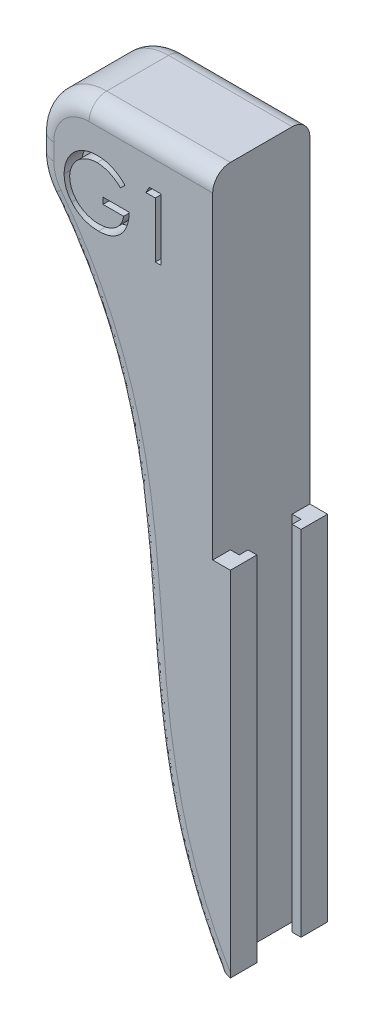
from build123d import *

# Parameters (mm, degrees)
EXTRUSION1_DEPTH = 5.5
EXTRUSION2_START = -19
EXTRUSION2_DEPTH = 20
CONG_5_R         = 3
CONG_6_R         = 1
EXTRUSION3_START = 4.5
EXTRUSION3_DEPTH = 1
EXTRUSION4_DEPTH = 1


# Read off the part's stored shape, not the designer's step: Extrusion3, Extrusion4
with BuildPart() as part:
    # Esquisse1 → Extrusion1 (new body)
    with BuildSketch(Plane.XY):
        with BuildLine():
            Line((0, 0), (0, 39))
            Line((0, 39), (-10, 39))
            Line((-10, 39), (-10, 34))
            add(Edge.make_bspline(
                [(-10, 34), (-7.394585864, 30.894988343), (-2.437496235, 20.047320541), (-4.724513139, 8.183096798), (0, 0)],
                knots=[0, 0, 0, 0, 0.313213028, 1, 1, 1, 1], degree=3))
        make_face()
    extrude(amount=EXTRUSION1_DEPTH)

    # Esquisse2 → Extrusion2 (add)
    with BuildSketch(Plane(origin=(0, 39, 0), x_dir=(1, 0, 0), z_dir=(0, 1, 0)).offset(EXTRUSION2_START)):
        Polygon((0, 0), (1, 0), (1, -1.5), (0.5, -1.5), (0.5, -1), (0, -1), align=None)
        Polygon((0, -5.5), (1, -5.5), (1, -4), (0.5, -4), (0.5, -4.5), (0, -4.5), align=None)
    extrude(amount=-EXTRUSION2_DEPTH)

    # Congé5
    cong_5_edges = [part.edges().sort_by_distance(p)[0] for p in [
        (-10, 39, 2.75),
        (-10, 34, 2.75),
    ]]
    fillet(cong_5_edges, radius=CONG_5_R)

    # Congé6
    cong_6_edges = [part.edges().sort_by_distance(p)[0] for p in [
        (-3.5, 39, 0),
        (-3.5, 39, 5.5),
        (-9.121320344, 38.121320344, 5.5),
        (-9.121320344, 38.121320344, 0),
        (-10, 35.528303094, 5.5),
        (-10, 35.528303094, 0),
        (-9.839363686, 34.088095032, 5.5),
        (-9.839363686, 34.088095032, 0),
        (-3.989072638, 16.865750758, 0),
        (-3.989072638, 16.865750758, 5.5),
    ]]
    fillet(cong_6_edges, radius=CONG_6_R)

    # Extrusion3 outline → Extrusion3 (cut)
    with BuildSketch(Plane.XY.offset(EXTRUSION3_START)):
        with BuildLine():
            add(Edge.make_bspline(
                [(-6.529186974, 36.577571008), (-6.49294873, 36.576991516), (-6.421092552, 36.575842452), (-6.314166819, 36.567877804), (-6.208893805, 36.555253923), (-6.105117415, 36.538027136), (-6.003191049, 36.514563446), (-5.902824343, 36.486485161), (-5.803871807, 36.453793339), (-5.706643558, 36.414804492), (-5.610485842, 36.370550867), (-5.514864001, 36.320737445), (-5.420104755, 36.26451244), (-5.326043774, 36.201708905), (-5.232087916, 36.133405487), (-5.139723274, 36.057648663), (-5.046720329, 35.977425907), (-4.986918515, 35.919743724), (-4.956570788, 35.890471649)],
                knots=[0, 0, 0, 0, 0.061616945, 0.122179161, 0.18221627, 0.241864129, 0.300960056, 0.359969068, 0.419032918, 0.478068687, 0.537992581, 0.59896023, 0.661321079, 0.725247569, 0.791220154, 0.858745972, 0.928317581, 1, 1, 1, 1], degree=3))
            add(Edge.make_bspline(
                [(-8.411698993, 34.739229662), (-8.411166755, 34.780395914), (-8.410109043, 34.862205222), (-8.397283527, 34.983662529), (-8.378882109, 35.102963222), (-8.351835055, 35.220009778), (-8.31773879, 35.33488037), (-8.275185304, 35.447628333), (-8.225640408, 35.558320205), (-8.168054912, 35.666194073), (-8.103970452, 35.769818486), (-8.034420232, 35.868776289), (-7.958416632, 35.961265354), (-7.877200832, 36.048457002), (-7.789803842, 36.129255849), (-7.697044418, 36.20440996), (-7.598851075, 36.274020146), (-7.494914895, 36.336989981), (-7.386787211, 36.393553601), (-7.274727209, 36.443142813), (-7.158769099, 36.484126128), (-7.039781621, 36.518899908), (-6.91686412, 36.544615049), (-6.790908583, 36.563263794), (-6.661258471, 36.576024394), (-6.573622442, 36.577050649), (-6.529186974, 36.577571008)],
                knots=[0, 0, 0, 0, 0.04203938, 0.083544465, 0.124643057, 0.165303063, 0.206170747, 0.24697072, 0.288329266, 0.329986533, 0.371797473, 0.412737629, 0.453459281, 0.494001342, 0.534380668, 0.574951545, 0.615891702, 0.657249559, 0.699006607, 0.740486274, 0.782325156, 0.824567455, 0.867041244, 0.910499531, 0.954619176, 1, 1, 1, 1], degree=3))
            add(Edge.make_bspline(
                [(-7.982612455, 33.559942803), (-8.016798387, 33.602613456), (-8.084602799, 33.687246473), (-8.171880956, 33.822846417), (-8.246282359, 33.963248278), (-8.306650181, 34.108842906), (-8.353788267, 34.259494119), (-8.38759452, 34.41500941), (-8.407401809, 34.575589041), (-8.410255347, 34.684254305), (-8.411698993, 34.739229662)],
                knots=[0, 0, 0, 0, 0.127895677, 0.253668418, 0.376738432, 0.499344473, 0.621999307, 0.745698548, 0.871345153, 1, 1, 1, 1], degree=3))
            add(Edge.make_bspline(
                [(-6.466086013, 32.898083828), (-6.505596148, 32.89865295), (-6.583522869, 32.89977544), (-6.698613797, 32.907752788), (-6.810531417, 32.920033364), (-6.919259426, 32.938578487), (-7.025197768, 32.961293142), (-7.127817353, 32.99037986), (-7.227509095, 33.02404856), (-7.324427081, 33.062344233), (-7.417691628, 33.10671589), (-7.507718145, 33.156025529), (-7.595004271, 33.21001889), (-7.678955436, 33.269629736), (-7.760009057, 33.334412196), (-7.837642501, 33.404496115), (-7.912290379, 33.479667235), (-7.959050842, 33.533046244), (-7.982612455, 33.559942803)],
                knots=[0, 0, 0, 0, 0.069236524, 0.136556739, 0.202094157, 0.26646426, 0.329768823, 0.391878966, 0.453270593, 0.514114664, 0.57438951, 0.634141664, 0.693923287, 0.754152196, 0.814470164, 0.87566063, 0.937348011, 1, 1, 1, 1], degree=3))
            add(Edge.make_bspline(
                [(-4.732211814, 34.692955623), (-4.733917662, 34.626048134), (-4.737256316, 34.495098093), (-4.760675231, 34.304127822), (-4.798491744, 34.123756129), (-4.850152055, 33.953793057), (-4.917027336, 33.794479464), (-4.998399864, 33.645653598), (-5.095571985, 33.508276917), (-5.205082427, 33.381227914), (-5.327982385, 33.267898701), (-5.460951004, 33.168292763), (-5.604207973, 33.084390148), (-5.75761778, 33.016129486), (-5.920678214, 32.962855491), (-6.093766594, 32.925083914), (-6.276648194, 32.902453951), (-6.401984871, 32.899562571), (-6.466086013, 32.898083828)],
                knots=[0, 0, 0, 0, 0.071272278, 0.139492722, 0.204635419, 0.26740574, 0.328445598, 0.388397163, 0.447733931, 0.507391621, 0.566767555, 0.625478338, 0.684066506, 0.743248446, 0.804033357, 0.866498751, 0.931723238, 1, 1, 1, 1], degree=3))
            Line((-4.732211814, 34.692955623), (-6.212981045, 34.692955623))
            Line((-6.212981045, 34.692955623), (-6.212981045, 34.333981264))
            Line((-6.212981045, 34.333981264), (-5.046314378, 34.333981264))
            add(Edge.make_bspline(
                [(-6.438742263, 33.257058187), (-6.393363915, 33.258006764), (-6.304256158, 33.259869447), (-6.173269715, 33.274369737), (-6.047466645, 33.29701653), (-5.927200441, 33.330182427), (-5.812331421, 33.372486102), (-5.702438479, 33.423481489), (-5.598386821, 33.485124548), (-5.499863647, 33.554698415), (-5.409106462, 33.632213247), (-5.327252338, 33.715857702), (-5.255606848, 33.805225769), (-5.193102149, 33.899791084), (-5.141393495, 34.000336389), (-5.0989507, 34.106368952), (-5.066417408, 34.217936464), (-5.053062433, 34.295028096), (-5.046314378, 34.333981264)],
                knots=[0, 0, 0, 0, 0.070630068, 0.138693613, 0.204917715, 0.269440883, 0.332636335, 0.395301694, 0.457763931, 0.52065702, 0.582851652, 0.643315198, 0.702580232, 0.760907539, 0.819489613, 0.878269076, 0.938491311, 1, 1, 1, 1], degree=3))
            add(Edge.make_bspline(
                [(-8.097596429, 34.753252098), (-8.096840711, 34.72098128), (-8.095331338, 34.656527767), (-8.085671018, 34.560333694), (-8.067742778, 34.465568292), (-8.043775069, 34.371920159), (-8.013794253, 34.279228911), (-7.976421587, 34.187896401), (-7.932155987, 34.09792601), (-7.880919435, 34.010128393), (-7.824733231, 33.92460537), (-7.76179015, 33.844045848), (-7.694929567, 33.767377071), (-7.621715667, 33.696301307), (-7.544496125, 33.62891741), (-7.460963849, 33.567081889), (-7.372761388, 33.509603665), (-7.279754176, 33.457207146), (-7.182951394, 33.41039861), (-7.083694641, 33.368774714), (-6.981666825, 33.334495377), (-6.877404136, 33.306557273), (-6.771030864, 33.283656976), (-6.662007061, 33.268924495), (-6.551134353, 33.258233664), (-6.476395721, 33.257451994), (-6.438742263, 33.257058187)],
                knots=[0, 0, 0, 0, 0.038994203, 0.077881926, 0.116651567, 0.155416065, 0.194618293, 0.234261464, 0.274547108, 0.315667309, 0.357019556, 0.398082512, 0.439097864, 0.479833278, 0.521274132, 0.562840828, 0.605292061, 0.64840866, 0.691727292, 0.735148885, 0.778368925, 0.821660858, 0.865523699, 0.909731498, 0.954522565, 1, 1, 1, 1], degree=3))
            add(Edge.make_bspline(
                [(-6.539703801, 36.218596649), (-6.573618501, 36.218183043), (-6.641359942, 36.217356904), (-6.741981886, 36.206812689), (-6.841548523, 36.191647825), (-6.939871897, 36.169705947), (-7.037143184, 36.141896887), (-7.133024076, 36.107111424), (-7.227693431, 36.06655618), (-7.320259512, 36.019693706), (-7.410000015, 35.96821386), (-7.494756851, 35.911165319), (-7.57507025, 35.850376529), (-7.649430675, 35.78432555), (-7.718265862, 35.713610685), (-7.783214234, 35.639547378), (-7.84199153, 35.56011216), (-7.895082695, 35.476766534), (-7.942444313, 35.390974345), (-7.984252966, 35.303561355), (-8.019350055, 35.2148175), (-8.04711951, 35.124631423), (-8.070030164, 35.033700833), (-8.086147771, 34.941396112), (-8.095234493, 34.847618427), (-8.096806273, 34.784821169), (-8.097596429, 34.753252098)],
                knots=[0, 0, 0, 0, 0.042841197, 0.085571284, 0.127718668, 0.170068387, 0.212787245, 0.255481593, 0.298877091, 0.342860572, 0.386527586, 0.429532376, 0.471886213, 0.513729302, 0.555081706, 0.596535237, 0.638120075, 0.679822212, 0.721331468, 0.761888364, 0.802199329, 0.841806293, 0.881060412, 0.920633226, 0.960101199, 1, 1, 1, 1], degree=3))
            add(Edge.make_bspline(
                [(-5.225801557, 35.635263316), (-5.274520446, 35.681094179), (-5.370796492, 35.771663042), (-5.527756735, 35.889174037), (-5.691520369, 35.989840137), (-5.861232866, 36.071746373), (-6.032691419, 36.137099134), (-6.203620196, 36.183627274), (-6.372265897, 36.213299811), (-6.484433115, 36.216848181), (-6.539703801, 36.218596649)],
                knots=[0, 0, 0, 0, 0.136144491, 0.269042539, 0.398516618, 0.527099539, 0.652282545, 0.771680405, 0.887494932, 1, 1, 1, 1], degree=3))
            Line((-5.225801557, 35.635263316), (-4.956570788, 35.890471649))
        make_face()
        Polygon((-3.584475436, 36.487827418), (-3.789904121, 36.128853059), (-3.251442583, 36.128853059), (-3.251442583, 32.987827418), (-2.937340019, 32.987827418), (-2.937340019, 36.487827418), align=None)
    extrude(amount=EXTRUSION3_DEPTH, mode=Mode.SUBTRACT)

    # Extrusion4 outline → Extrusion4 (cut)
    with BuildSketch(Plane.XY):
        with BuildLine():
            add(Edge.make_bspline(
                [(-2.589928904, 35.726162156), (-2.590461142, 35.767328408), (-2.591518854, 35.849137716), (-2.60434437, 35.970595023), (-2.622745788, 36.089895716), (-2.649792842, 36.206942272), (-2.683889107, 36.321812864), (-2.726442593, 36.434560827), (-2.775987489, 36.545252699), (-2.833572985, 36.653126567), (-2.897657445, 36.75675098), (-2.967207665, 36.855708783), (-3.043211265, 36.948197848), (-3.124427065, 37.035389496), (-3.211824055, 37.116188343), (-3.304583479, 37.191342454), (-3.402776822, 37.26095264), (-3.506713002, 37.323922475), (-3.614840686, 37.380486095), (-3.726900687, 37.430075307), (-3.842858798, 37.471058622), (-3.961846276, 37.505832402), (-4.084763777, 37.531547543), (-4.210719314, 37.550196288), (-4.340369426, 37.562956888), (-4.428005455, 37.563983143), (-4.472440923, 37.564503502)],
                knots=[0, 0, 0, 0, 0.04203938, 0.083544465, 0.124643057, 0.165303063, 0.206170747, 0.24697072, 0.288329266, 0.329986533, 0.371797473, 0.412737629, 0.453459281, 0.494001342, 0.534380668, 0.574951545, 0.615891702, 0.657249559, 0.699006607, 0.740486274, 0.782325156, 0.824567455, 0.867041244, 0.910499531, 0.954619176, 1, 1, 1, 1], degree=3))
            add(Edge.make_bspline(
                [(-4.472440923, 37.564503502), (-4.508679167, 37.56392401), (-4.580535345, 37.562774946), (-4.687461078, 37.554810298), (-4.792734092, 37.542186417), (-4.896510482, 37.52495963), (-4.998436848, 37.50149594), (-5.098803554, 37.473417655), (-5.19775609, 37.440725833), (-5.294984339, 37.401736986), (-5.391142055, 37.357483361), (-5.486763896, 37.307669939), (-5.581523142, 37.251444934), (-5.675584123, 37.188641399), (-5.769539981, 37.120337981), (-5.861904623, 37.044581157), (-5.954907568, 36.964358401), (-6.014709382, 36.906676218), (-6.045057109, 36.877404143)],
                knots=[0, 0, 0, 0, 0.061616945, 0.122179161, 0.18221627, 0.241864129, 0.300960056, 0.359969068, 0.419032918, 0.478068687, 0.537992581, 0.59896023, 0.661321079, 0.725247569, 0.791220154, 0.858745972, 0.928317581, 1, 1, 1, 1], degree=3))
            Line((-6.045057109, 36.877404143), (-5.77582634, 36.62219581))
            add(Edge.make_bspline(
                [(-5.77582634, 36.62219581), (-5.727107451, 36.668026673), (-5.630831405, 36.758595536), (-5.473871162, 36.876106531), (-5.310107528, 36.976772631), (-5.140395031, 37.058678867), (-4.968936477, 37.124031628), (-4.798007701, 37.170559768), (-4.629362, 37.200232305), (-4.517194781, 37.203780675), (-4.461924096, 37.205529143)],
                knots=[0, 0, 0, 0, 0.136144491, 0.269042539, 0.398516618, 0.527099539, 0.652282545, 0.771680405, 0.887494932, 1, 1, 1, 1], degree=3))
            add(Edge.make_bspline(
                [(-4.461924096, 37.205529143), (-4.428009396, 37.205115537), (-4.360267955, 37.204289398), (-4.259646011, 37.193745183), (-4.160079374, 37.178580319), (-4.061756, 37.156638441), (-3.964484713, 37.128829381), (-3.868603821, 37.094043918), (-3.773934466, 37.053488674), (-3.681368385, 37.0066262), (-3.591627882, 36.955146354), (-3.506871046, 36.898097813), (-3.426557647, 36.837309023), (-3.352197222, 36.771258044), (-3.283362035, 36.700543179), (-3.218413663, 36.626479872), (-3.159636367, 36.547044654), (-3.106545202, 36.463699028), (-3.059183584, 36.377906839), (-3.01737493, 36.290493849), (-2.982277842, 36.201749994), (-2.954508387, 36.111563917), (-2.931597733, 36.020633327), (-2.915480126, 35.928328606), (-2.906393404, 35.834550921), (-2.904821624, 35.771753663), (-2.904031468, 35.740184592)],
                knots=[0, 0, 0, 0, 0.042841197, 0.085571284, 0.127718668, 0.170068387, 0.212787245, 0.255481593, 0.298877091, 0.342860572, 0.386527586, 0.429532376, 0.471886213, 0.513729302, 0.555081706, 0.596535237, 0.638120075, 0.679822212, 0.721331468, 0.761888364, 0.802199329, 0.841806293, 0.881060412, 0.920633226, 0.960101199, 1, 1, 1, 1], degree=3))
            add(Edge.make_bspline(
                [(-2.904031468, 35.740184592), (-2.904787186, 35.707913774), (-2.906296559, 35.643460261), (-2.915956879, 35.547266188), (-2.933885119, 35.452500786), (-2.957852828, 35.358852653), (-2.987833644, 35.266161405), (-3.02520631, 35.174828895), (-3.06947191, 35.084858504), (-3.120708462, 34.997060887), (-3.176894666, 34.911537864), (-3.239837747, 34.830978342), (-3.30669833, 34.754309565), (-3.37991223, 34.683233801), (-3.457131772, 34.615849904), (-3.540664048, 34.554014383), (-3.628866509, 34.496536159), (-3.72187372, 34.44413964), (-3.818676503, 34.397331104), (-3.917933256, 34.355707208), (-4.019961072, 34.321427871), (-4.124223761, 34.293489767), (-4.230597033, 34.27058947), (-4.339620836, 34.255856989), (-4.450493544, 34.245166158), (-4.525232176, 34.244384488), (-4.562885634, 34.243990681)],
                knots=[0, 0, 0, 0, 0.038994203, 0.077881926, 0.116651567, 0.155416065, 0.194618293, 0.234261464, 0.274547108, 0.315667309, 0.357019556, 0.398082512, 0.439097864, 0.479833278, 0.521274132, 0.562840828, 0.605292061, 0.64840866, 0.691727292, 0.735148885, 0.778368925, 0.821660858, 0.865523699, 0.909731498, 0.954522565, 1, 1, 1, 1], degree=3))
            add(Edge.make_bspline(
                [(-4.562885634, 34.243990681), (-4.608263982, 34.244939258), (-4.697371739, 34.246801941), (-4.828358182, 34.261302231), (-4.954161252, 34.283949024), (-5.074427456, 34.317114921), (-5.189296476, 34.359418596), (-5.299189418, 34.410413983), (-5.403241076, 34.472057042), (-5.50176425, 34.541630909), (-5.592521435, 34.619145741), (-5.674375559, 34.702790196), (-5.746021049, 34.792158263), (-5.808525748, 34.886723578), (-5.860234402, 34.987268883), (-5.902677197, 35.093301446), (-5.935210489, 35.204868958), (-5.948565464, 35.28196059), (-5.955313519, 35.320913758)],
                knots=[0, 0, 0, 0, 0.070630068, 0.138693613, 0.204917715, 0.269440883, 0.332636335, 0.395301694, 0.457763931, 0.52065702, 0.582851652, 0.643315198, 0.702580232, 0.760907539, 0.819489613, 0.878269076, 0.938491311, 1, 1, 1, 1], degree=3))
            Line((-5.955313519, 35.320913758), (-4.788646852, 35.320913758))
            Line((-4.788646852, 35.320913758), (-4.788646852, 35.679888117))
            Line((-4.788646852, 35.679888117), (-6.269416083, 35.679888117))
            add(Edge.make_bspline(
                [(-6.269416083, 35.679888117), (-6.267710235, 35.612980629), (-6.264371581, 35.482030587), (-6.240952666, 35.291060316), (-6.203136153, 35.110688623), (-6.151475842, 34.940725551), (-6.084600561, 34.781411958), (-6.003228033, 34.632586092), (-5.906055912, 34.495209411), (-5.79654547, 34.368160408), (-5.673645512, 34.254831195), (-5.540676892, 34.155225257), (-5.397419924, 34.071322642), (-5.244010117, 34.00306198), (-5.080949683, 33.949787985), (-4.907861303, 33.912016408), (-4.724979703, 33.889386445), (-4.599643026, 33.886495065), (-4.535541884, 33.885016322)],
                knots=[0, 0, 0, 0, 0.071272278, 0.139492722, 0.204635419, 0.26740574, 0.328445598, 0.388397163, 0.447733931, 0.507391621, 0.566767555, 0.625478338, 0.684066506, 0.743248446, 0.804033357, 0.866498751, 0.931723238, 1, 1, 1, 1], degree=3))
            add(Edge.make_bspline(
                [(-4.535541884, 33.885016322), (-4.496031749, 33.885585444), (-4.418105028, 33.886707934), (-4.3030141, 33.894685282), (-4.19109648, 33.906965858), (-4.082368471, 33.925510981), (-3.976430129, 33.948225636), (-3.873810544, 33.977312354), (-3.774118802, 34.010981054), (-3.677200816, 34.049276727), (-3.583936269, 34.093648384), (-3.493909752, 34.142958023), (-3.406623626, 34.196951384), (-3.322672461, 34.25656223), (-3.24161884, 34.32134469), (-3.163985396, 34.391428609), (-3.089337518, 34.466599729), (-3.042577055, 34.519978738), (-3.019015442, 34.546875297)],
                knots=[0, 0, 0, 0, 0.069236524, 0.136556739, 0.202094157, 0.26646426, 0.329768823, 0.391878966, 0.453270593, 0.514114664, 0.57438951, 0.634141664, 0.693923287, 0.754152196, 0.814470164, 0.87566063, 0.937348011, 1, 1, 1, 1], degree=3))
            add(Edge.make_bspline(
                [(-3.019015442, 34.546875297), (-2.98482951, 34.58954595), (-2.917025098, 34.674178967), (-2.829746941, 34.809778911), (-2.755345538, 34.950180772), (-2.694977716, 35.0957754), (-2.64783963, 35.246426613), (-2.614033377, 35.401941904), (-2.594226088, 35.562521535), (-2.59137255, 35.671186799), (-2.589928904, 35.726162156)],
                knots=[0, 0, 0, 0, 0.127895677, 0.253668418, 0.376738432, 0.499344473, 0.621999307, 0.745698548, 0.871345153, 1, 1, 1, 1], degree=3))
        make_face()
        Polygon((-7.211723775, 37.115785553), (-7.417152461, 37.474759912), (-8.064287878, 37.474759912), (-8.064287878, 33.974759912), (-7.750185314, 33.974759912), (-7.750185314, 37.115785553), align=None)
    extrude(amount=EXTRUSION4_DEPTH, mode=Mode.SUBTRACT)


solid = part.part
